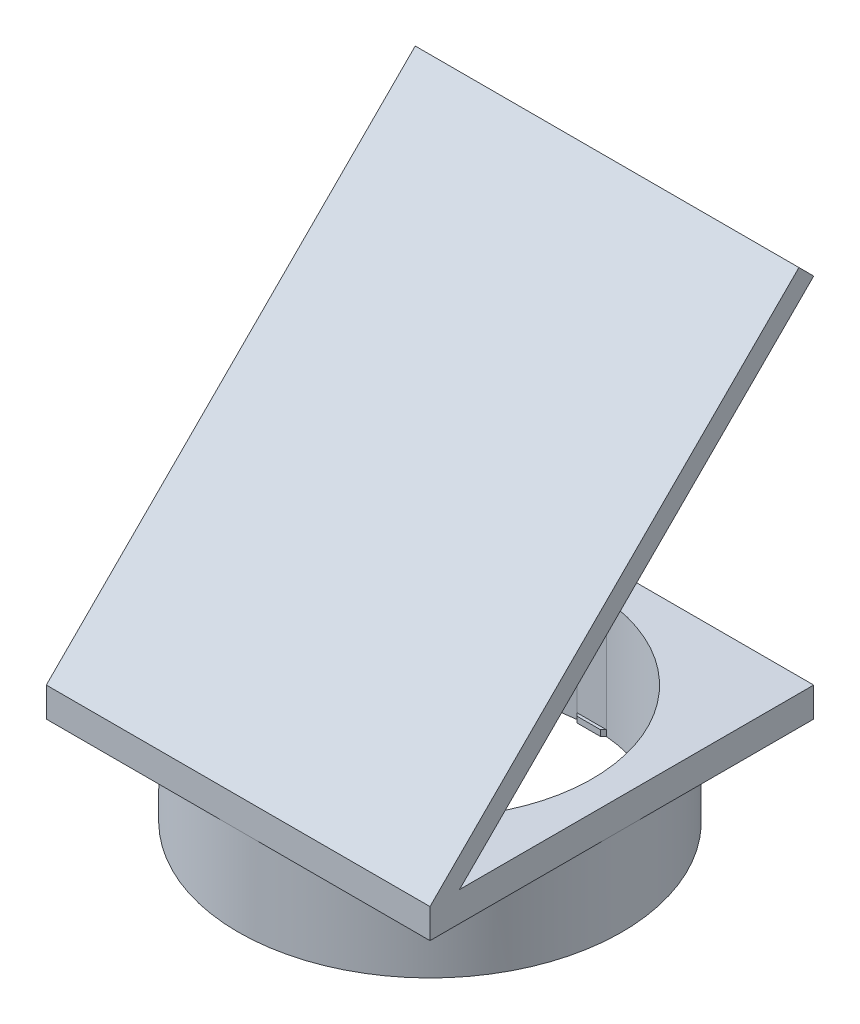
from build123d import *

# Parameters (mm, degrees)
SKETCH1_R           = 13
BOSS_EXTRUDE1_DEPTH = 6
SKETCH2_W           = 2
SKETCH2_H           = 0.4
BOSS_EXTRUDE2_DEPTH = 0.2
SKETCH3_W           = 2
SKETCH3_H           = 0.4
BOSS_EXTRUDE3_DEPTH = 0.2
SKETCH4_W           = 2
SKETCH4_H           = 0.4
BOSS_EXTRUDE4_DEPTH = 0.2
CHAMFER1_SIZE       = 0.2
SKETCH5_W           = 2
SKETCH5_H           = 0.4
BOSS_EXTRUDE5_DEPTH = 0.2
CHAMFER2_SIZE       = 0.2
SKETCH6_W           = 26
SKETCH6_H           = 26
BOSS_EXTRUDE6_DEPTH = 2
SKETCH7_R           = 11
CUT_EXTRUDE1_DEPTH  = 2
BOSS_EXTRUDE7_DEPTH = 26


with BuildPart() as part:
    # Sketch1 → Boss-Extrude1 (new body)
    with BuildSketch(Plane(origin=(0, 0, 0), x_dir=(1, 0, 0), z_dir=(0, 1, 0))):
        with Locations(Location((0, 0, 0), (0, 0, 270))):
            Circle(SKETCH1_R)
        with BuildLine():
            Line((-1, 10.95445115), (1, 10.95445115))
            ThreePointArc((1, 10.95445115), (7.778174593, 7.778174593), (10.95445115, 1))
            Line((10.95445115, 1), (10.95445115, -1))
            ThreePointArc((10.95445115, -1), (7.778174593, -7.778174593), (1, -10.95445115))
            Line((1, -10.95445115), (-1, -10.95445115))
            ThreePointArc((-1, -10.95445115), (-7.778174593, -7.778174593), (-10.95445115, -1))
            Line((-10.95445115, -1), (-10.95445115, 1))
            ThreePointArc((-10.95445115, 1), (-7.778174593, 7.778174593), (-1, 10.95445115))
        make_face(mode=Mode.SUBTRACT)
    extrude(amount=BOSS_EXTRUDE1_DEPTH)

    # Sketch2 → Boss-Extrude2 (add)
    with BuildSketch(Plane.XY.offset(-10.95445115)):
        with Locations((0, 0.2)):
            Rectangle(SKETCH2_W, SKETCH2_H)
    extrude(amount=BOSS_EXTRUDE2_DEPTH)

    # Sketch3 → Boss-Extrude3 (add)
    with BuildSketch(Plane(origin=(-10.95445115, 0, 0), x_dir=(0, 0, -1), z_dir=(1, 0, 0))):
        with Locations((0, 0.2)):
            Rectangle(SKETCH3_W, SKETCH3_H)
    extrude(amount=BOSS_EXTRUDE3_DEPTH)

    # Sketch4 → Boss-Extrude4 (add)
    with BuildSketch(Plane(origin=(0, 0, 10.95445115), x_dir=(-1, 0, 0), z_dir=(0, 0, -1))):
        with Locations((0, 0.2)):
            Rectangle(SKETCH4_W, SKETCH4_H)
    extrude(amount=BOSS_EXTRUDE4_DEPTH)

    # Chamfer1
    chamfer1_edges = [part.edges().sort_by_distance(p)[0] for p in [
        (1, 0.2, -10.75445115),
        (-1, 0.2, -10.75445115),
        (-10.75445115, 0.2, 1),
        (-10.75445115, 0.2, -1),
        (-1, 0.2, 10.75445115),
        (1, 0.2, 10.75445115),
    ]]
    chamfer(chamfer1_edges, length=CHAMFER1_SIZE - 0.0001)  # a hair under: the kernel refuses the full size

    # Sketch5 → Boss-Extrude5 (add)
    with BuildSketch(Plane.ZY.offset(-10.95445115)):
        with Locations((0, 0.2)):
            Rectangle(SKETCH5_W, SKETCH5_H)
    extrude(amount=BOSS_EXTRUDE5_DEPTH)

    # Chamfer2
    chamfer2_edges = [part.edges().sort_by_distance(p)[0] for p in [
        (10.75445115, 0.2, 1),
        (10.75445115, 0.2, -1),
    ]]
    chamfer(chamfer2_edges, length=CHAMFER2_SIZE - 0.0001)  # a hair under: the kernel refuses the full size

    # Sketch6 → Boss-Extrude6 (add)
    with BuildSketch(Plane(origin=(0, 6, 0), x_dir=(1, 0, 0), z_dir=(0, 1, 0))):
        Rectangle(SKETCH6_W, SKETCH6_H)
    extrude(amount=BOSS_EXTRUDE6_DEPTH)

    # Sketch7 → Cut-Extrude1 (cut)
    with BuildSketch(Plane.XZ.offset(-6)):
        with Locations(Location((0, 0, 0), (0, 0, 270))):
            Circle(SKETCH7_R)
    extrude(amount=-CUT_EXTRUDE1_DEPTH, mode=Mode.SUBTRACT)

    # Sketch8 → Boss-Extrude7 (add)
    with BuildSketch(Plane(origin=(13, 0, 0), x_dir=(0, 0, -1), z_dir=(1, 0, 0))):
        Polygon((-13, 8), (12.000151011, 33.000151011), (13, 32.000302023), (-11.000302023, 8), align=None)
    extrude(amount=-BOSS_EXTRUDE7_DEPTH)


solid = part.part
